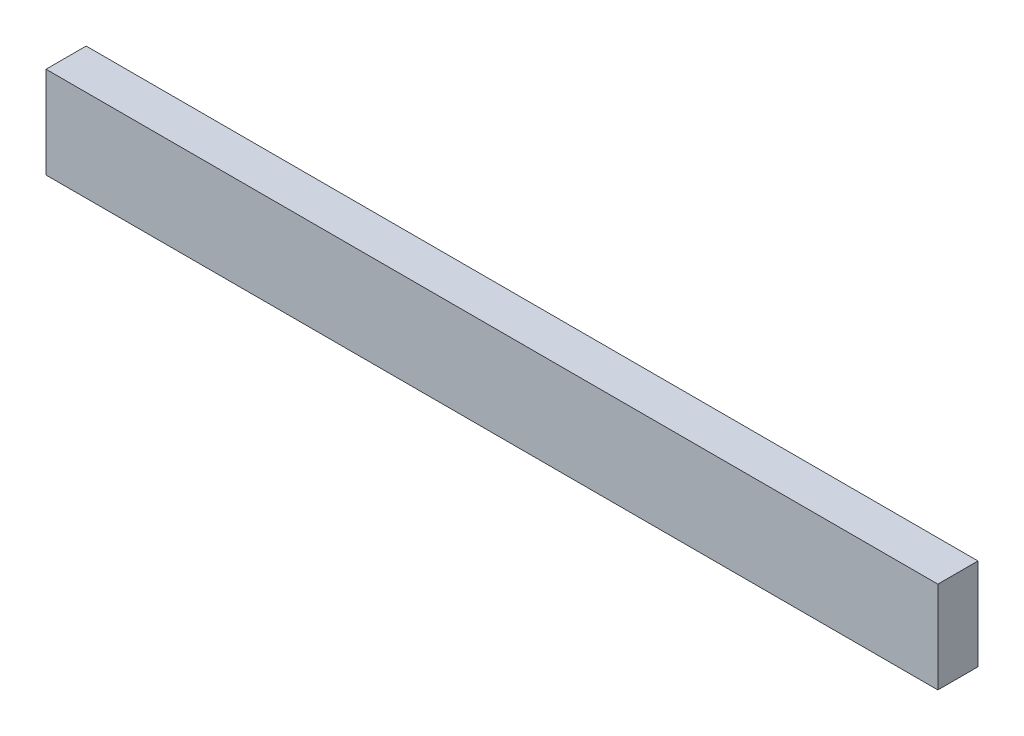
from build123d import *

# Parameters (mm, degrees)
SKETCH1_W           = 400
SKETCH1_H           = 41.107307338
BOSS_EXTRUDE1_DEPTH = 18


with BuildPart() as part:
    # Sketch1 → Boss-Extrude1 (new body)
    with BuildSketch(Plane.XY):
        with Locations((-200, 20.553653669)):
            Rectangle(SKETCH1_W, SKETCH1_H)
    extrude(amount=BOSS_EXTRUDE1_DEPTH)


solid = part.part
